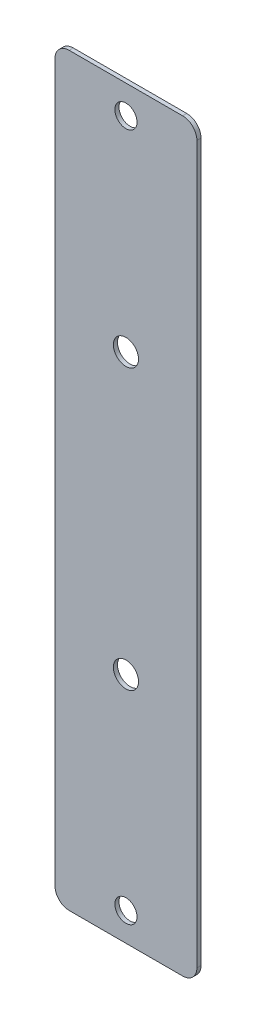
from build123d import *

# Parameters (mm, degrees)
SKETCH1_W                       = 25.4
SKETCH1_H                       = 133.35
BASE_FLANGE1_DEPTH              = 0.7366
BREAK_CORNER1_START             = -0.7366
BREAK_CORNER1_DEPTH             = 0.7366
M4_CLEARANCE_HOLE2_D            = 4.5
F_5_32_0_15625_DIAMETER_HOLE2_D = 3.96875


# Read off the part's stored shape, not the designer's step: Break-Corner1
# Sheet-metal steps are written as plain solids
with BuildPart() as part:
    # Sketch1 → Base-Flange1 (new body)
    with BuildSketch(Plane.XY):
        with Locations((12.7, 66.675)):
            Rectangle(SKETCH1_W, SKETCH1_H)
    extrude(amount=-BASE_FLANGE1_DEPTH)

    # Break-Corner1 outline → Break-Corner1 (cut)
    with BuildSketch(Plane.XY.offset(BREAK_CORNER1_START)):
        with BuildLine():
            ThreePointArc((2.54, 0), (0.743948776, 0.743948776), (0, 2.54))
            Line((0, 2.54), (0, 0))
            Line((0, 0), (2.54, 0))
        make_face()
        with BuildLine():
            Line((0, 133.35), (0, 130.81))
            ThreePointArc((0, 130.81), (0.743948776, 132.606051224), (2.54, 133.35))
            Line((2.54, 133.35), (0, 133.35))
        make_face()
        with BuildLine():
            ThreePointArc((25.4, 2.54), (24.656051224, 0.743948776), (22.86, 0))
            Line((22.86, 0), (25.4, 0))
            Line((25.4, 0), (25.4, 2.54))
        make_face()
        with BuildLine():
            Line((25.4, 133.35), (22.86, 133.35))
            ThreePointArc((22.86, 133.35), (24.656051224, 132.606051224), (25.4, 130.81))
            Line((25.4, 130.81), (25.4, 133.35))
        make_face()
    extrude(amount=BREAK_CORNER1_DEPTH, mode=Mode.SUBTRACT)

    # M4 Clearance Hole2 (through all)
    with Locations(Plane.XY):
        with Locations((12.7, 91.675), (12.7, 41.675)):
            Hole(M4_CLEARANCE_HOLE2_D / 2)

    # 5/32 (0.15625) Diameter Hole2 (through all)
    with Locations(Plane.XY):
        with Locations((12.7, 5.08), (12.7, 128.27)):
            Hole(F_5_32_0_15625_DIAMETER_HOLE2_D / 2)


solid = part.part
